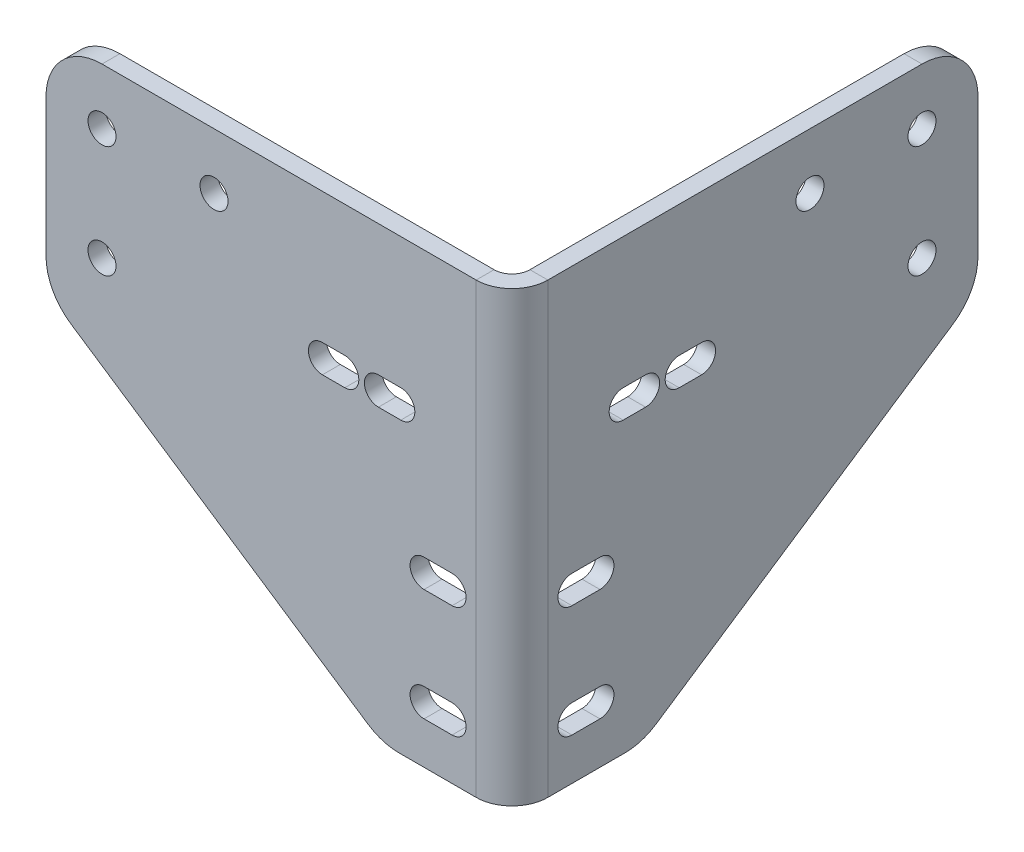
from build123d import *

# Parameters (mm, degrees)
BOSS_EXTRUDE1_DEPTH        = 3.175
SKETCH2_R                  = 2.5
CUT_EXTRUDE2_DEPTH         = 10
SKETCH8_W                  = 3.175
SKETCH8_H                  = 3.175
BOSS_EXTRUDE2_DEPTH        = 80
CONVERT_SOLID2_START       = 2.233560192
CONVERT_SOLID2_OUTLINE_W   = 3.175
CONVERT_SOLID2_OUTLINE_H   = 23.379999999
CONVERT_SOLID2_OUTLINE_H_2 = 19.120000001
CONVERT_SOLID2_OUTLINE_H_3 = 15
CONVERT_SOLID2_DEPTH       = 0.941439808
CONVERT_SOLID2_START_2     = -3.2
CONVERT_SOLID2_2_OUTLINE_R = 2.5
CONVERT_SOLID2_2_DEPTH     = 3.650867885
CONVERT_SOLID2_START_3     = -80
CONVERT_SOLID2_3_OUTLINE_W = 0.025
CONVERT_SOLID2_3_OUTLINE_H = 80
CONVERT_SOLID2_3_DEPTH     = 77.404032
CONVERT_SOLID2_START_4     = 3.175
CONVERT_SOLID2_4_OUTLINE_R = 2.5
CONVERT_SOLID2_4_DEPTH     = 0.025
CONVERT_SOLID2_START_5     = -54.620000001
CONVERT_SOLID2_5_DEPTH     = 67.5
CONVERT_SOLID2_START_6     = -67.120000001
CONVERT_SOLID2_6_DEPTH     = 80
CONVERT_SOLID2_START_7     = 24.325
CONVERT_SOLID2_7_OUTLINE_R = 2.5
CONVERT_SOLID2_7_DEPTH     = 0.675
FILLET1_R                  = 10


with BuildPart() as part:
    # Sketch1 → Boss-Extrude1 (new body)
    with BuildSketch(Plane.XY):
        Polygon((-58.85, 12.879999999), (-58.85, -27.120000001), (1.15, -67.120000001), (21.15, -67.120000001), (21.15, 12.879999999), align=None)
    extrude(amount=BOSS_EXTRUDE1_DEPTH)

    # Sketch2 → Cut-Extrude2 (cut)
    with BuildSketch(Plane.XY.offset(3.175)):
        with Locations((-48.85, 2.879999999)):
            Circle(SKETCH2_R)
        with Locations((-48.85, -17.12)):
            Circle(SKETCH2_R)
        with Locations((-28.85, 2.879999999)):
            Circle(SKETCH2_R)
        with BuildLine():
            Line((8.65, -54.620000001), (13.65, -54.620000001))
            ThreePointArc((13.65, -54.620000001), (16.15, -57.120000001), (13.65, -59.620000001))
            Line((13.65, -59.620000001), (8.65, -59.620000001))
            ThreePointArc((8.65, -59.620000001), (6.15, -57.120000001), (8.65, -54.620000001))
        make_face()
        with BuildLine():
            Line((8.65, -34.620000001), (13.65, -34.620000001))
            ThreePointArc((13.65, -34.620000001), (16.15, -37.120000001), (13.65, -39.620000001))
            Line((13.65, -39.620000001), (8.65, -39.620000001))
            ThreePointArc((8.65, -39.620000001), (6.15, -37.120000001), (8.65, -34.620000001))
        make_face()
        with BuildLine():
            Line((-5.5, -15.5), (-9.5, -15.5))
            ThreePointArc((-9.5, -15.5), (-12, -13), (-9.5, -10.5))
            Line((-9.5, -10.5), (-5.5, -10.5))
            ThreePointArc((-5.5, -10.5), (-3, -13), (-5.5, -15.5))
        make_face()
        with BuildLine():
            Line((0.5, -10.5), (4.5, -10.5))
            ThreePointArc((4.5, -10.5), (7, -13), (4.5, -15.5))
            Line((4.5, -15.5), (0.5, -15.5))
            ThreePointArc((0.5, -15.5), (-2, -13), (0.5, -10.5))
        make_face()
    extrude(amount=-CUT_EXTRUDE2_DEPTH, mode=Mode.SUBTRACT)


with BuildPart() as body_2:
    # Mirror1: mirrored copy
    add(part.part.mirror(Plane(origin=(10.575, 0, -10.575), x_dir=(0.7071067811865489, 0, 0.7071067811865462), z_dir=(0.7071067811865464, 0, -0.7071067811865488))))


with BuildPart() as part_1:
    add(part.part)

    add(body_2.part)  # Boss-Extrude2 merges body 2
    # Sketch8 → Boss-Extrude2 (add, through all)
    with BuildSketch(Plane(origin=(0, 12.879999999, 0), x_dir=(1, 0, 0), z_dir=(0, 1, 0))):
        with Locations((22.7375, -1.5875)):
            Rectangle(SKETCH8_W, SKETCH8_H)
    extrude(amount=-BOSS_EXTRUDE2_DEPTH)

    # Convert-Solid2: read off the stored shape, not the designer's step
    # Convert-Solid2 outline → Convert-Solid2 (cut)
    with BuildSketch(Plane.XY.offset(CONVERT_SOLID2_START)):
        with Locations((22.7375, 1.19)):
            Rectangle(CONVERT_SOLID2_OUTLINE_W, CONVERT_SOLID2_OUTLINE_H)
        with Locations((22.7375, -25.060000001)):
            Rectangle(CONVERT_SOLID2_OUTLINE_W, CONVERT_SOLID2_OUTLINE_H_2)
        with Locations((22.7375, -47.120000001)):
            Rectangle(CONVERT_SOLID2_OUTLINE_W, CONVERT_SOLID2_OUTLINE_H_3)
    extrude(amount=CONVERT_SOLID2_DEPTH, mode=Mode.SUBTRACT)

    # Convert-Solid2 2 outline → Convert-Solid2 2 (add)
    with BuildSketch(Plane.XY.offset(CONVERT_SOLID2_START_2)):
        Polygon((21.15, 12.879999999), (-58.85, 12.879999999), (-58.85, -27.120000001), (1.15, -67.120000001), (21.15, -67.120000001), align=None)
        with BuildLine():
            Line((13.65, -59.620000001), (8.65, -59.620000001))
            ThreePointArc((8.65, -59.620000001), (6.15, -57.120000001), (8.65, -54.620000001))
            Line((8.65, -54.620000001), (13.65, -54.620000001))
            ThreePointArc((13.65, -54.620000001), (16.15, -57.120000001), (13.65, -59.620000001))
        make_face(mode=Mode.SUBTRACT)
        with BuildLine():
            Line((13.65, -39.620000001), (8.65, -39.620000001))
            ThreePointArc((8.65, -39.620000001), (6.15, -37.120000001), (8.65, -34.620000001))
            Line((8.65, -34.620000001), (13.65, -34.620000001))
            ThreePointArc((13.65, -34.620000001), (16.15, -37.120000001), (13.65, -39.620000001))
        make_face(mode=Mode.SUBTRACT)
        with Locations((-48.85, -17.12)):
            Circle(CONVERT_SOLID2_2_OUTLINE_R, mode=Mode.SUBTRACT)
        with Locations((-48.85, 2.879999999)):
            Circle(CONVERT_SOLID2_2_OUTLINE_R, mode=Mode.SUBTRACT)
        with Locations((-28.85, 2.879999999)):
            Circle(CONVERT_SOLID2_2_OUTLINE_R, mode=Mode.SUBTRACT)
        with BuildLine():
            Line((-9.5, -10.5), (-5.5, -10.5))
            ThreePointArc((-5.5, -10.5), (-3, -13), (-5.5, -15.5))
            Line((-5.5, -15.5), (-9.5, -15.5))
            ThreePointArc((-9.5, -15.5), (-12, -13), (-9.5, -10.5))
        make_face(mode=Mode.SUBTRACT)
        with BuildLine():
            Line((0.5, -10.5), (4.5, -10.5))
            ThreePointArc((4.5, -10.5), (7, -13), (4.5, -15.5))
            Line((4.5, -15.5), (0.5, -15.5))
            ThreePointArc((0.5, -15.5), (-2, -13), (0.5, -10.5))
        make_face(mode=Mode.SUBTRACT)
    extrude(amount=CONVERT_SOLID2_2_DEPTH)

    # Convert-Solid2 3 outline → Convert-Solid2 3 (add)
    with BuildSketch(Plane.XY.offset(CONVERT_SOLID2_START_3)):
        with Locations((24.3375, -27.120000001)):
            Rectangle(CONVERT_SOLID2_3_OUTLINE_W, CONVERT_SOLID2_3_OUTLINE_H)
    extrude(amount=CONVERT_SOLID2_3_DEPTH)

    # Convert-Solid2 4 outline → Convert-Solid2 4 (add)
    with BuildSketch(Plane.XY.offset(CONVERT_SOLID2_START_4)):
        Polygon((21.15, 12.879999999), (-58.85, 12.879999999), (-58.85, -27.120000001), (1.15, -67.120000001), (21.15, -67.120000001), align=None)
        with BuildLine():
            Line((13.65, -59.620000001), (8.65, -59.620000001))
            ThreePointArc((8.65, -59.620000001), (6.15, -57.120000001), (8.65, -54.620000001))
            Line((8.65, -54.620000001), (13.65, -54.620000001))
            ThreePointArc((13.65, -54.620000001), (16.15, -57.120000001), (13.65, -59.620000001))
        make_face(mode=Mode.SUBTRACT)
        with BuildLine():
            Line((13.65, -39.620000001), (8.65, -39.620000001))
            ThreePointArc((8.65, -39.620000001), (6.15, -37.120000001), (8.65, -34.620000001))
            Line((8.65, -34.620000001), (13.65, -34.620000001))
            ThreePointArc((13.65, -34.620000001), (16.15, -37.120000001), (13.65, -39.620000001))
        make_face(mode=Mode.SUBTRACT)
        with Locations((-48.85, -17.12)):
            Circle(CONVERT_SOLID2_4_OUTLINE_R, mode=Mode.SUBTRACT)
        with Locations((-48.85, 2.879999999)):
            Circle(CONVERT_SOLID2_4_OUTLINE_R, mode=Mode.SUBTRACT)
        with Locations((-28.85, 2.879999999)):
            Circle(CONVERT_SOLID2_4_OUTLINE_R, mode=Mode.SUBTRACT)
        with BuildLine():
            Line((-9.5, -10.5), (-5.5, -10.5))
            ThreePointArc((-5.5, -10.5), (-3, -13), (-5.5, -15.5))
            Line((-5.5, -15.5), (-9.5, -15.5))
            ThreePointArc((-9.5, -15.5), (-12, -13), (-9.5, -10.5))
        make_face(mode=Mode.SUBTRACT)
        with BuildLine():
            Line((0.5, -10.5), (4.5, -10.5))
            ThreePointArc((4.5, -10.5), (7, -13), (4.5, -15.5))
            Line((4.5, -15.5), (0.5, -15.5))
            ThreePointArc((0.5, -15.5), (-2, -13), (0.5, -10.5))
        make_face(mode=Mode.SUBTRACT)
    extrude(amount=CONVERT_SOLID2_4_DEPTH)

    # Convert-Solid2 5 outline → Convert-Solid2 5 (add)
    with BuildSketch(Plane(origin=(0, 0, 0), x_dir=(1, 0, 0), z_dir=(0, 1, 0)).offset(CONVERT_SOLID2_START_5)):
        with BuildLine():
            Line((21.15, -2.233560192), (21.15, -2.342562585))
            ThreePointArc((21.15, -2.342562585), (21.241340362, -2.288813955), (21.331778178, -2.233560192))
            Line((21.331778178, -2.233560192), (21.15, -2.233560192))
        make_face()
    extrude(amount=CONVERT_SOLID2_5_DEPTH)

    # Convert-Solid2 6 outline → Convert-Solid2 6 (cut)
    with BuildSketch(Plane(origin=(0, 0, 0), x_dir=(1, 0, 0), z_dir=(0, 1, 0)).offset(CONVERT_SOLID2_START_6)):
        with BuildLine():
            Line((-58.85, 3.2), (-58.85, 0))
            Line((-58.85, 0), (17.95, 0))
            ThreePointArc((17.95, 0), (20.2127417, 0.9372583), (21.15, 3.2))
            Line((21.15, 3.2), (-58.85, 3.2))
        make_face()
        with BuildLine():
            Line((17.95, -3.2), (21.15, -3.2))
            Line((21.15, -3.2), (21.15, -3.175))
            Line((21.15, -3.175), (24.325, -3.175))
            Line((24.325, -3.175), (24.325, 2.595968))
            Line((24.325, 2.595968), (24.35, 2.595968))
            Line((24.35, 2.595968), (24.35, 3.2))
            ThreePointArc((24.35, 3.2), (22.4754834, -1.3254834), (17.95, -3.2))
        make_face()
    extrude(amount=CONVERT_SOLID2_6_DEPTH, mode=Mode.SUBTRACT)

    # Convert-Solid2 7 outline → Convert-Solid2 7 (cut)
    with BuildSketch(Plane.YZ.offset(CONVERT_SOLID2_START_7)):
        Polygon((-27.120000001, -80), (-67.120000001, -20), (-67.120000001, -80), align=None)
        with BuildLine():
            Line((-59.620000001, -7.5), (-59.620000001, -12.5))
            ThreePointArc((-59.620000001, -12.5), (-57.120000001, -15), (-54.620000001, -12.5))
            Line((-54.620000001, -12.5), (-54.620000001, -7.5))
            ThreePointArc((-54.620000001, -7.5), (-57.120000001, -5), (-59.620000001, -7.5))
        make_face()
        with BuildLine():
            Line((-39.620000001, -7.5), (-39.620000001, -12.5))
            ThreePointArc((-39.620000001, -12.5), (-37.120000001, -15), (-34.620000001, -12.5))
            Line((-34.620000001, -12.5), (-34.620000001, -7.5))
            ThreePointArc((-34.620000001, -7.5), (-37.120000001, -5), (-39.620000001, -7.5))
        make_face()
        with BuildLine():
            Line((-10.5, -30.65), (-10.5, -26.65))
            ThreePointArc((-10.5, -26.65), (-13, -24.15), (-15.5, -26.65))
            Line((-15.5, -26.65), (-15.5, -30.65))
            ThreePointArc((-15.5, -30.65), (-13, -33.15), (-10.5, -30.65))
        make_face()
        with BuildLine():
            Line((-10.5, -20.65), (-10.5, -16.65))
            ThreePointArc((-10.5, -16.65), (-13, -14.15), (-15.5, -16.65))
            Line((-15.5, -16.65), (-15.5, -20.65))
            ThreePointArc((-15.5, -20.65), (-13, -23.15), (-10.5, -20.65))
        make_face()
        with Locations((2.879999999, -50)):
            Circle(CONVERT_SOLID2_7_OUTLINE_R)
        with Locations((-17.12, -70)):
            Circle(CONVERT_SOLID2_7_OUTLINE_R)
        with Locations((2.879999999, -70)):
            Circle(CONVERT_SOLID2_7_OUTLINE_R)
    extrude(amount=CONVERT_SOLID2_7_DEPTH, mode=Mode.SUBTRACT)

    # Fillet1
    fillet1_edges = [part_1.edges().sort_by_distance(p)[0] for p in [
        (1.15, -67.120000001, 1.5875),
        (22.7375, -67.120000001, -20),
        (22.7375, -27.120000001, -80),
        (22.7375, 12.879999999, -80),
        (-58.85, 12.879999999, 1.5875),
        (-58.85, -27.120000001, 1.5875),
    ]]
    fillet(fillet1_edges, radius=FILLET1_R)


solid = part_1.part
